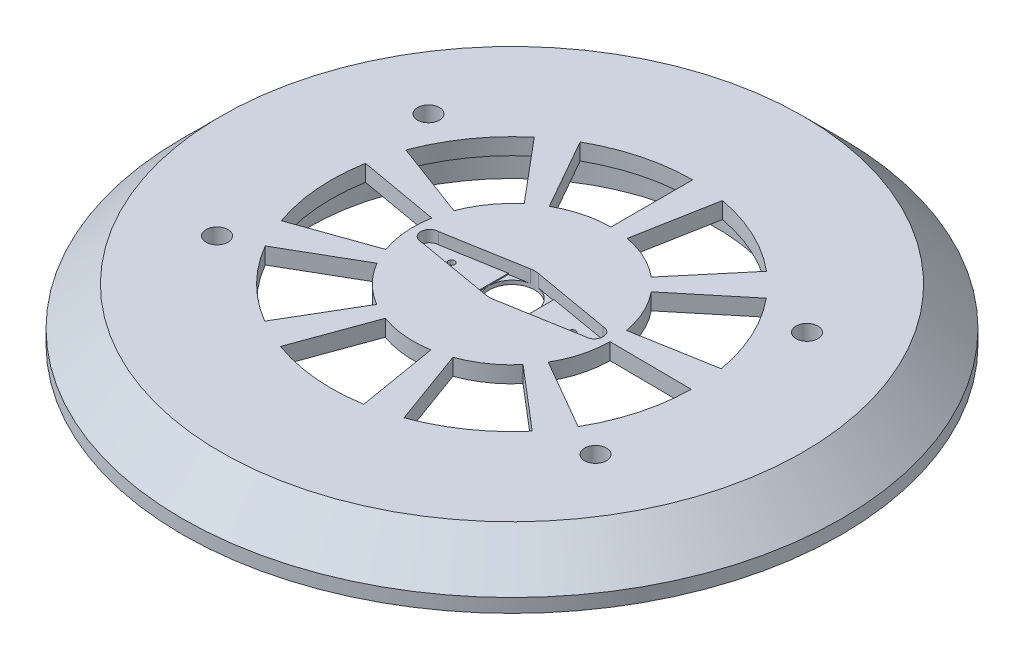
from build123d import *

# Parameters (mm, degrees)
SKETCH1_R           = 60
SKETCH1_R_2         = 4.15
SKETCH1_R_3         = 0.6
BOSS_EXTRUDE1_DEPTH = 3
BOSS_EXTRUDE2_START = -6.5
SKETCH1_5_R         = 60
SKETCH1_5_R_2       = 56.4
SKETCH1_5_R_3       = 40.6
SKETCH1_5_R_4       = 37
BOSS_EXTRUDE2_DEPTH = 6.5
FILLET1_R           = 8
CHAMFER1_SIZE       = 7
CUT_EXTRUDE1_START  = -2.1
CUT_EXTRUDE1_DEPTH  = 2.1
SKETCH3_R           = 2
CUT_EXTRUDE2_DEPTH  = 5
FILLET2_R           = 5
CUT_EXTRUDE4_START  = -0.2
CUT_EXTRUDE4_DEPTH  = 0.2


with BuildPart() as part:
    # Sketch1 → Boss-Extrude1 (new body)
    with BuildSketch(Plane(origin=(0, 0, 0), x_dir=(1, 0, 0), z_dir=(0, 1, 0))):
        with Locations(Location((0, 0, 0), (0, 0, 270))):
            Circle(SKETCH1_R)
        with Locations(Location((0, 0, 0), (0, 0, 270))):
            Circle(SKETCH1_R_2, mode=Mode.SUBTRACT)
        with Locations(Location((-11, 0, 0), (0, 0, 270))):
            Circle(SKETCH1_R_3, mode=Mode.SUBTRACT)
        with Locations(Location((11, 0, 0), (0, 0, 270))):
            Circle(SKETCH1_R_3, mode=Mode.SUBTRACT)
        with BuildLine():
            Line((-11.570176974, 13.788799976), (-21.143111218, 25.197378752))
            ThreePointArc((-21.143111218, 25.197378752), (-26.867310164, 18.975950371), (-30.816661277, 11.500975423))
            Line((-30.816661277, 11.500975423), (-16.863848516, 6.293696309))
            ThreePointArc((-16.863848516, 6.293696309), (-14.702639088, 10.384238241), (-11.570176974, 13.788799976))
        make_face(mode=Mode.SUBTRACT)
        with BuildLine():
            Line((-8.872947439, 15.661123962), (-16.214247626, 28.618826354))
            ThreePointArc((-16.214247626, 28.618826354), (-8.384047872, 31.806395414), (0, 32.892841895))
            Line((0, 32.892841895), (0, 18))
            ThreePointArc((0, 18), (-4.588015295, 17.405462236), (-8.872947439, 15.661123962))
        make_face(mode=Mode.SUBTRACT)
        with BuildLine():
            Line((3.269704356, 17.700537659), (5.974992691, 32.345610371))
            ThreePointArc((5.974992691, 32.345610371), (14.022203597, 29.754274554), (21.143111218, 25.197378752))
            Line((21.143111218, 25.197378752), (11.570176974, 13.788799976))
            ThreePointArc((11.570176974, 13.788799976), (7.673391845, 16.28247701), (3.269704356, 17.700537659))
        make_face(mode=Mode.SUBTRACT)
        with BuildLine():
            Line((13.882425145, 11.457673066), (25.368467523, 20.937523814))
            ThreePointArc((25.368467523, 20.937523814), (29.867310164, 13.779797948), (32.393125717, 5.711782053))
            Line((32.393125717, 5.711782053), (17.726539554, 3.125667198))
            ThreePointArc((17.726539554, 3.125667198), (16.34433366, 7.540739832), (13.882425145, 11.457673066))
        make_face(mode=Mode.SUBTRACT)
        with BuildLine():
            Line((15.588457268, -9), (28.486036684, -16.446420948))
            ThreePointArc((28.486036684, -16.446420948), (31.737170367, -8.642399263), (32.891754462, -0.26746283))
            Line((32.891754462, -0.26746283), (17.999404922, -0.146364092))
            ThreePointArc((17.999404922, -0.146364092), (17.367580109, -4.72939332), (15.588457268, -9))
        make_face(mode=Mode.SUBTRACT)
        with BuildLine():
            Line((13.694263095, -11.681915865), (25.024623937, -21.347300644))
            ThreePointArc((25.024623937, -21.347300644), (18.756855836, -27.020721809), (11.250014499, -30.909160806))
            Line((11.250014499, -30.909160806), (6.15636258, -16.914467174))
            ThreePointArc((6.15636258, -16.914467174), (10.264342805, -14.786590776), (13.694263095, -11.681915865))
        make_face(mode=Mode.SUBTRACT)
        with BuildLine():
            Line((2.981423371, -17.751369375), (5.448193754, -32.438499237))
            ThreePointArc((5.448193754, -32.438499237), (-3, -32.755748319), (-11.250014499, -30.909160806))
            Line((-11.250014499, -30.909160806), (-6.15636258, -16.914467174))
            ThreePointArc((-6.15636258, -16.914467174), (-1.641694572, -17.924978073), (2.981423371, -17.751369375))
        make_face(mode=Mode.SUBTRACT)
        with BuildLine():
            Line((-9.126457483, -15.51475987), (-16.677506836, -28.351363524))
            ThreePointArc((-16.677506836, -28.351363524), (-23.353122495, -23.163996151), (-28.486036684, -16.446420948))
            Line((-28.486036684, -16.446420948), (-15.588457268, -9))
            ThreePointArc((-15.588457268, -9), (-12.779564814, -12.676068916), (-9.126457483, -15.51475987))
        make_face(mode=Mode.SUBTRACT)
        with BuildLine():
            Line((-16.963967452, -6.018621794), (-30.999616628, -10.998309728))
            ThreePointArc((-30.999616628, -10.998309728), (-32.779059433, -2.733552745), (-32.393125717, 5.711782053))
            Line((-32.393125717, 5.711782053), (-17.726539554, 3.125667198))
            ThreePointArc((-17.726539554, 3.125667198), (-17.93773465, -1.495886234), (-16.963967452, -6.018621794))
        make_face(mode=Mode.SUBTRACT)
    extrude(amount=BOSS_EXTRUDE1_DEPTH)

    # Sketch1<5> → Boss-Extrude2 (add)
    # profile 1 of 2: a face of its own
    with BuildSketch(Plane(origin=(0, 0, 0), x_dir=(1, 0, 0), z_dir=(0, 1, 0)).offset(BOSS_EXTRUDE2_START)):
        with Locations(Location((0, 0, 0), (0, 0, 270))):
            Circle(SKETCH1_5_R)
        with Locations(Location((0, 0, 0), (0, 0, 270))):
            Circle(SKETCH1_5_R_2, mode=Mode.SUBTRACT)
    # profile 2 of 2: a face of its own
    with BuildSketch(Plane(origin=(0, 0, 0), x_dir=(1, 0, 0), z_dir=(0, 1, 0)).offset(BOSS_EXTRUDE2_START)):
        with Locations(Location((0, 0, 0), (0, 0, 270))):
            Circle(SKETCH1_5_R_3)
        with Locations(Location((0, 0, 0), (0, 0, 270))):
            Circle(SKETCH1_5_R_4, mode=Mode.SUBTRACT)
    extrude(amount=BOSS_EXTRUDE2_DEPTH)

    # Fillet1
    # the kernel refuses this fillet: 8 mm, written as the material it adds along each edge
    with BuildSketch(Plane(origin=(0, 0, 0), x_dir=(0, 0, 1), z_dir=(-1, 0, 0))) as fillet1_piece_1:
        with BuildLine():
            CenterArc((48.541883177, -8), FILLET1_R, 10.806922875, 79.193077125)
            Line((48.541883177, 0), (48.541883177, 0.16))
            Line((48.541883177, 0.16), (56.4, 0.16))
            Line((56.4, 0.16), (56.56, 0))
            ThreePointArc((56.56, 0), (56.56, -3.25), (56.557162336, -6.47))
            Line((56.557162336, -6.47), (56.4, -6.5))
        make_face()
    revolve(axis=Axis((0, 0, 0), (0, 1, 0)))
    with BuildSketch(Plane(origin=(0, 0, 0), x_dir=(0, 0, 1), z_dir=(-1, 0, 0))) as fillet1_piece_2:
        with BuildLine():
            CenterArc((48.458116823, -8), FILLET1_R, 90, 79.193077125)
            Line((40.6, -6.5), (40.442837664, -6.47))
            ThreePointArc((40.442837664, -6.47), (40.44, -3.25), (40.44, 0))
            Line((40.44, 0), (40.6, 0.16))
            Line((40.6, 0.16), (48.458116823, 0.16))
            Line((48.458116823, 0.16), (48.458116823, 0))
        make_face()
    revolve(axis=Axis((0, 0, 0), (0, 1, 0)))

    # Chamfer1
    chamfer1_edges = [part.edges().sort_by_distance(p)[0] for p in [
        (0, 3, -60),
    ]]
    chamfer(chamfer1_edges, length=CHAMFER1_SIZE)

    # Sketch2 → Cut-Extrude1 (cut)
    with BuildSketch(Plane(origin=(0, 3, 0), x_dir=(1, 0, 0), z_dir=(0, 1, 0)).offset(CUT_EXTRUDE1_START)):
        with BuildLine():
            Line((0.712064808, -4.088454929), (15, -1.6))
            ThreePointArc((15, -1.6), (16.6, 0), (15, 1.6))
            Line((15, 1.6), (0.712064808, 4.088454929))
            ThreePointArc((0.712064808, 4.088454929), (0, 4.15), (-0.712064808, 4.088454929))
            Line((-0.712064808, 4.088454929), (-15, 1.6))
            ThreePointArc((-15, 1.6), (-16.6, 0), (-15, -1.6))
            Line((-15, -1.6), (-0.712064808, -4.088454929))
            ThreePointArc((-0.712064808, -4.088454929), (0, -4.15), (0.712064808, -4.088454929))
        make_face()
    extrude(amount=CUT_EXTRUDE1_DEPTH, mode=Mode.SUBTRACT)

    # Sketch3 → Cut-Extrude2 (cut)
    with BuildSketch(Plane(origin=(0, 3, 0), x_dir=(1, 0, 0), z_dir=(0, 1, 0))):
        with Locations(Location((-34.458294856, -19.25, 0), (0, 0, 270))):
            Circle(SKETCH3_R)
        with Locations(Location((-34.458294856, 19.25, 0), (0, 0, 270))):
            Circle(SKETCH3_R)
        with Locations(Location((34.458294856, 19.25, 0), (0, 0, 270))):
            Circle(SKETCH3_R)
        with Locations(Location((34.458294856, -19.25, 0), (0, 0, 270))):
            Circle(SKETCH3_R)
    extrude(amount=-CUT_EXTRUDE2_DEPTH, mode=Mode.SUBTRACT)

    # Fillet2
    fillet2_edges = [part.edges().sort_by_distance(p)[0] for p in [
        (0, -6.5, -56.4),
        (0, -6.5, -40.6),
    ]]
    fillet(fillet2_edges, radius=FILLET2_R)

    # Sketch4 → Cut-Extrude4 (cut)
    with BuildSketch(Plane(origin=(0, 0.9, 0), x_dir=(1, 0, 0), z_dir=(0, 1, 0)).offset(CUT_EXTRUDE4_START)):
        with BuildLine():
            ThreePointArc((-4.15, -1e-08), (-3.1762847, 2.670901627), (-0.712064808, 4.088454929))
            Line((-0.712064808, 4.088454929), (-4.15, 3.489687741))
            Line((-4.15, 3.489687741), (-4.15, -1e-08))
        make_face()
        with BuildLine():
            ThreePointArc((-0.712064808, -4.088454929), (-3.176284694, -2.670901635), (-4.15, -1e-08))
            Line((-4.15, -1e-08), (-4.15, -3.489687741))
            Line((-4.15, -3.489687741), (-0.712064808, -4.088454929))
        make_face()
        with BuildLine():
            ThreePointArc((0.712064808, 4.088454929), (3.176284696, 2.670901632), (4.15, 3e-09))
            Line((4.15, 3e-09), (4.15, 3.489687741))
            Line((4.15, 3.489687741), (0.712064808, 4.088454929))
        make_face()
        with BuildLine():
            ThreePointArc((4.15, 3e-09), (3.176284698, -2.67090163), (0.712064808, -4.088454929))
            Line((0.712064808, -4.088454929), (4.15, -3.489687741))
            Line((4.15, -3.489687741), (4.15, 3e-09))
        make_face()
    extrude(amount=CUT_EXTRUDE4_DEPTH, mode=Mode.SUBTRACT)


solid = part.part
